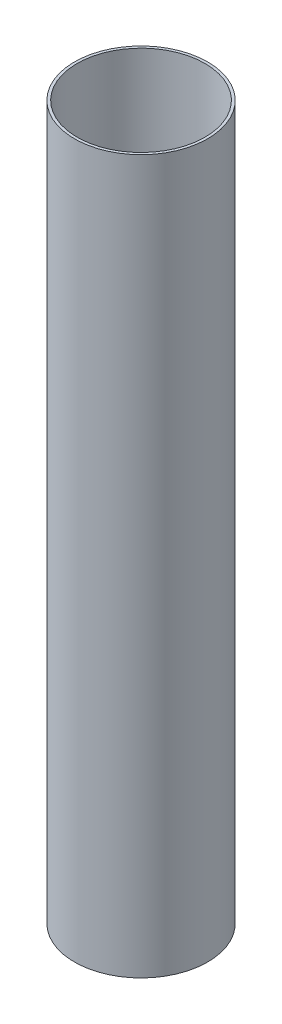
from build123d import *

# Parameters (mm, degrees)
SKETCH1_R           = 28.4734
SKETCH1_R_2         = 27.3304
BOSS_EXTRUDE1_DEPTH = 304.8


with BuildPart() as part:
    # Sketch1 → Boss-Extrude1 (new body)
    with BuildSketch(Plane(origin=(0, 0, 0), x_dir=(1, 0, 0), z_dir=(0, 1, 0))):
        Circle(SKETCH1_R)
        Circle(SKETCH1_R_2, mode=Mode.SUBTRACT)
    extrude(amount=BOSS_EXTRUDE1_DEPTH)


solid = part.part
